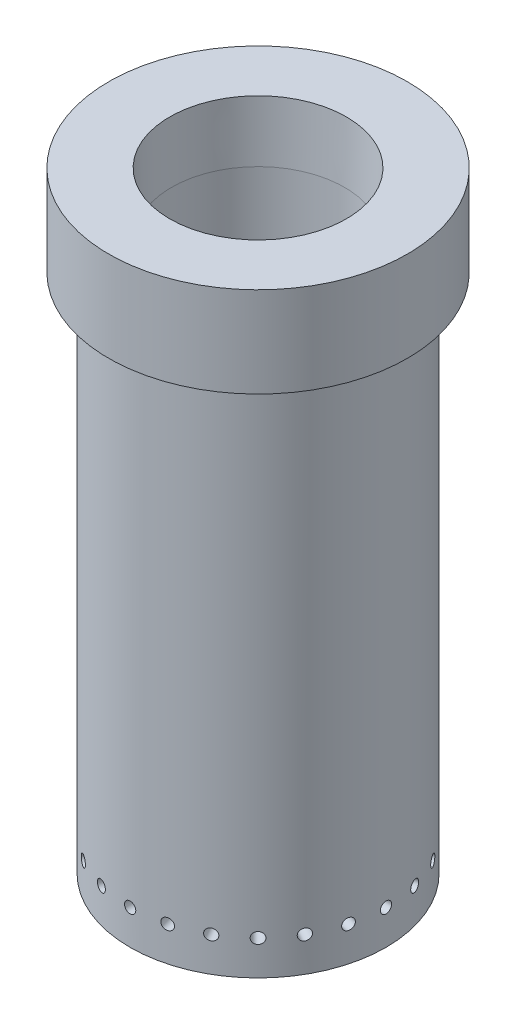
from build123d import *

# Parameters (mm, degrees)
CHAMFER2_SIZE        = 5.08
CHAMFER2_SIZE2       = 12.264204897
SKETCH6_R            = 0.59055
CUT_EXTRUDE_49_DEPTH = 74.005825966
CIRPATTERN1_COUNT    = 24


# Read off the part's stored shape, not the designer's step: pipe-tap-geometry
with BuildPart() as part:
    # Sketch1 → Revolve1 (revolve)
    with BuildSketch(Plane.XY, mode=Mode.PRIVATE) as revolve1_sk:
        Polygon((0, 0), (-15.75, 0), (-15.75, -9.525), (-13.5, -9.525), (-13.5, -69.525), (0, -69.525), align=None)
    revolve(revolve1_sk.sketch.rotate(Axis((0, 0, 0), (0, 1, 0)), 270), axis=Axis((0, 0, 0), (0, 1, 0)))

    # Sketch3 → 1/2 NPT Tapped Hole1 (revolve, cut)
    with BuildSketch(Plane(origin=(0, 0, 0), x_dir=(0, 0, 1), z_dir=(1, 0, 0))):
        Polygon((0, 0), (0, 66.010993174), (9.128125, 62.23), (9.128125, 13.462), (10.261665792, 13.462), (10.6647361, 0), align=None)
    revolve(axis=Axis((0, 6.35, 0), (0, -1, 0)), mode=Mode.SUBTRACT)

    # Chamfer2
    chamfer2_edges = [part.edges().sort_by_distance(p)[0] for p in [
        (0, -69.525, 13.5),
    ]]
    chamfer2_side = [part.faces().sort_by_distance(p)[0] for p in [
        (0, -39.525, 13.5),
    ]]
    chamfer(chamfer2_edges, length=CHAMFER2_SIZE, length2=CHAMFER2_SIZE2, reference=chamfer2_side[0])

    # Sketch6 → #49 (cut, through all)
    with BuildSketch(Plane.XY):
        with Locations((0, -60.7949)):
            Circle(SKETCH6_R)
    cut_extrude_49 = extrude(amount=-CUT_EXTRUDE_49_DEPTH, mode=Mode.SUBTRACT)

    # CirPattern1: #49 ×24 about axis
    cirpattern1_axis = Axis((0, -69.525, 0), (0, 1, 0))
    for i in range(1, CIRPATTERN1_COUNT):
        add(cut_extrude_49.rotate(cirpattern1_axis, i * 360 / CIRPATTERN1_COUNT), mode=Mode.SUBTRACT)

    # pipe-tap-geometry outline → pipe-tap-geometry (revolve)
    with BuildSketch(Plane.XY):
        Polygon((9.128125, -6.339322729), (9.128125, -13.462), (10.261665792, -13.462), (10.6647361, 0), (9.317932812, 0), align=None)
    revolve(axis=Axis((0, 0, 0), (0, 1, 0)))

    # Sketch8 → Cut-Revolve1 (revolve, cut)
    with BuildSketch(Plane.XY, mode=Mode.PRIVATE) as cut_revolve1_sk:
        Polygon((-9.128125, -62.23), (-5.008125, -66.35), (0, -66.35), (0, -62.23), align=None)
    revolve(cut_revolve1_sk.sketch.rotate(Axis((0, -66.35, 0), (0, 1, 0)), 90), axis=Axis((0, -66.35, 0), (0, 1, 0)), mode=Mode.SUBTRACT)


solid = part.part
